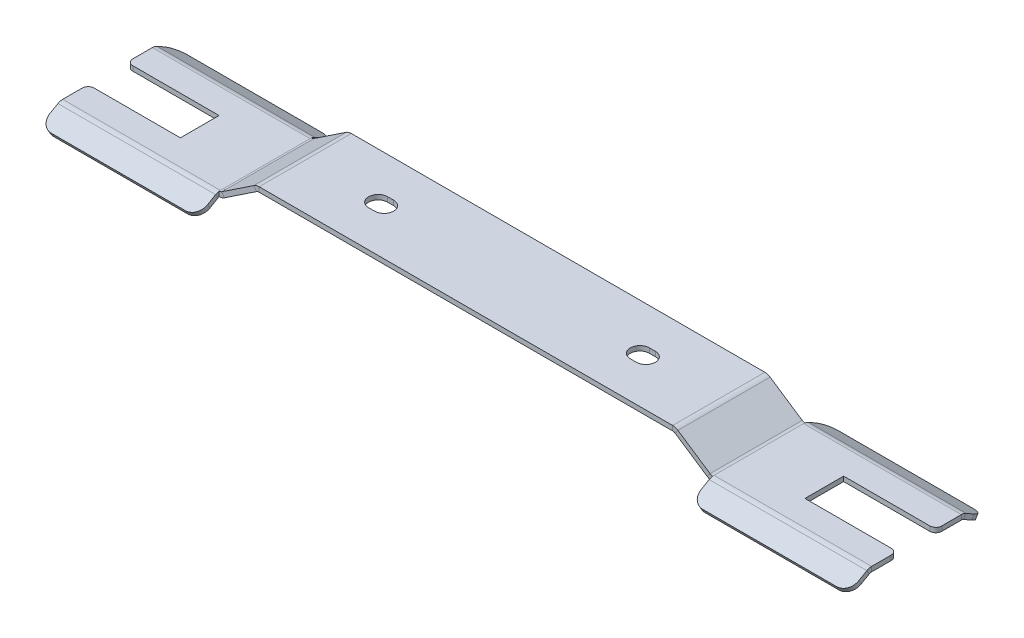
from build123d import *

# Parameters (mm, degrees)
SM_BASE_FLANGE_1_DEPTH             = 77.5
SKETCH_6_W                         = 155
SKETCH_6_H                         = 65
CUT_EXTRUDE_1_DEPTH                = 687.083267541
CUT_EXTRUDE_2_DEPTH                = 687.083267541
SM_EDGE_FLANGE_2_STRIP_CUT_DEPTH   = 265.155589796
SM_EDGE_FLANGE_2_STRIP_CUT_2_DEPTH = 265.155589796
SM_EDGE_FLANGE_2_STRIP_CUT_3_DEPTH = 265.155589796
SM_EDGE_FLANGE_2_STRIP_CUT_4_DEPTH = 265.155589796
SM_EDGE_FLANGE_2_DEPTH             = 265.155589796
SM_EDGE_FLANGE_2_BEND_DEPTH        = 265.155589796
SM_EDGE_FLANGE_2_BEND_2_DEPTH      = 265.155589796
SM_EDGE_FLANGE_2_BEND_3_DEPTH      = 265.155589796
FILLET_1_R                         = 10
FILLET_2_R                         = 20


# Sheet-metal steps are written as plain solids
with BuildPart() as part:
    # Sketch 1 → 基体-法兰1 (new, symmetric)
    with BuildSketch(Plane.XY):
        with BuildLine():
            Line((-680, -40), (-414.844410204, -40))
            ThreePointArc((-414.844410204, -40), (-410.207863825, -39.313472424), (-405.969207064, -37.312804709))
            Line((-405.969207064, -37.312804709), (-352.015396468, -1.343597645))
            ThreePointArc((-352.015396468, -1.343597645), (-349.896068088, -0.343263788), (-347.577794898, 0))
            Line((-347.577794898, 0), (347.577794898, 0))
            ThreePointArc((347.577794898, 0), (349.896068088, -0.343263788), (352.015396468, -1.343597645))
            Line((352.015396468, -1.343597645), (405.969207064, -37.312804709))
            ThreePointArc((405.969207064, -37.312804709), (410.207863825, -39.313472424), (414.844410204, -40))
            Line((414.844410204, -40), (680, -40))
            Line((680, -40), (680, -32))
            Line((680, -32), (414.844410204, -32))
            ThreePointArc((414.844410204, -32), (412.526137014, -31.656736212), (410.406808634, -30.656402355))
            Line((410.406808634, -30.656402355), (356.452998038, 5.312804709))
            ThreePointArc((356.452998038, 5.312804709), (352.214341277, 7.313472424), (347.577794898, 8))
            Line((347.577794898, 8), (-347.577794898, 8))
            ThreePointArc((-347.577794898, 8), (-352.214341277, 7.313472424), (-356.452998038, 5.312804709))
            Line((-356.452998038, 5.312804709), (-410.406808634, -30.656402355))
            ThreePointArc((-410.406808634, -30.656402355), (-412.526137014, -31.656736212), (-414.844410204, -32))
            Line((-414.844410204, -32), (-680, -32))
            Line((-680, -32), (-680, -40))
        make_face()
    extrude(amount=SM_BASE_FLANGE_1_DEPTH, both=True)

    # 草图6 → 切除-拉伸1 (cut, through all)
    with BuildSketch(Plane(origin=(0, 8, 0), x_dir=(1, 0, 0), z_dir=(0, 1, 0))):
        with Locations((-602.5, 0)):
            Rectangle(SKETCH_6_W, SKETCH_6_H)
        with Locations((602.5, 0)):
            Rectangle(SKETCH_6_W, SKETCH_6_H)
    extrude(amount=-CUT_EXTRUDE_1_DEPTH, mode=Mode.SUBTRACT)

    # 草图7 → 切除-拉伸2 (cut, through all)
    with BuildSketch(Plane(origin=(0, 8, 0), x_dir=(1, 0, 0), z_dir=(0, 1, 0))):
        with BuildLine():
            Line((-225, 16), (-215, 16))
            ThreePointArc((-215, 16), (-199, 0), (-215, -16))
            Line((-215, -16), (-225, -16))
            ThreePointArc((-225, -16), (-241, 0), (-225, 16))
        make_face()
        with BuildLine():
            Line((215, 16), (225, 16))
            ThreePointArc((225, 16), (241, 0), (225, -16))
            Line((225, -16), (215, -16))
            ThreePointArc((215, -16), (199, 0), (215, 16))
        make_face()
    extrude(amount=-CUT_EXTRUDE_2_DEPTH, mode=Mode.SUBTRACT)

    # 边线-法兰2 strip (across the edge) → 边线-法兰2 strip cut (cut)
    with BuildSketch(Plane(origin=(-680, -40, -77.5), x_dir=(0, -0.8660254037844416, 0.49999999999999495), z_dir=(1, 0, 0))):
        Polygon((-29.856406461, 35.712812921), (-5.856406461, -5.856406461), (1.07179677, -1.856406461), (-22.92820323, 39.712812921), align=None)
    extrude(amount=SM_EDGE_FLANGE_2_STRIP_CUT_DEPTH, mode=Mode.SUBTRACT)

    # 边线-法兰2 strip 2 (across the edge) → 边线-法兰2 strip cut 2 (cut)
    with BuildSketch(Plane(origin=(680, -40, 77.5), x_dir=(0, -0.8660254037844416, -0.49999999999999495), z_dir=(-1, 0, 0))):
        Polygon((-29.856406461, 35.712812921), (-5.856406461, -5.856406461), (1.07179677, -1.856406461), (-22.92820323, 39.712812921), align=None)
    extrude(amount=SM_EDGE_FLANGE_2_STRIP_CUT_2_DEPTH, mode=Mode.SUBTRACT)

    # 边线-法兰2 strip 3 (across the edge) → 边线-法兰2 strip cut 3 (cut)
    with BuildSketch(Plane(origin=(414.844410204, -40, -77.5), x_dir=(0, -0.8660254037844416, 0.49999999999999495), z_dir=(1, 0, 0))):
        Polygon((-29.856406461, 35.712812921), (-5.856406461, -5.856406461), (1.07179677, -1.856406461), (-22.92820323, 39.712812921), align=None)
    extrude(amount=SM_EDGE_FLANGE_2_STRIP_CUT_3_DEPTH, mode=Mode.SUBTRACT)

    # 边线-法兰2 strip 4 (across the edge) → 边线-法兰2 strip cut 4 (cut)
    with BuildSketch(Plane(origin=(-414.844410204, -40, 77.5), x_dir=(0, -0.8660254037844416, -0.49999999999999495), z_dir=(-1, 0, 0))):
        Polygon((-29.856406461, 35.712812921), (-5.856406461, -5.856406461), (1.07179677, -1.856406461), (-22.92820323, 39.712812921), align=None)
    extrude(amount=SM_EDGE_FLANGE_2_STRIP_CUT_4_DEPTH, mode=Mode.SUBTRACT)

    # 边线-法兰2 section (across the edge) → 边线-法兰2 (add)
    with BuildSketch(Plane(origin=(-680, -40, -77.5), x_dir=(0, -0.8660254037844416, 0.49999999999999495), z_dir=(1, 0, 0))):
        with BuildLine():
            Line((-8, 2.143593539), (-8, 37.856406461))
            Line((-8, 37.856406461), (0, 37.856406461))
            Line((0, 37.856406461), (0, 2.143593539))
            ThreePointArc((0, 2.143593539), (0.27259339, 0.073041179), (1.07179677, -1.856406461))
            Line((1.07179677, -1.856406461), (-5.856406461, -5.856406461))
            ThreePointArc((-5.856406461, -5.856406461), (-7.454813221, -1.997511182), (-8, 2.143593539))
        make_face()
    extrude(amount=SM_EDGE_FLANGE_2_DEPTH)

    # 边线-法兰2 section 2 (across the edge) → 边线-法兰2 bend (add)
    with BuildSketch(Plane(origin=(680, -40, 77.5), x_dir=(0, -0.8660254037844416, -0.49999999999999495), z_dir=(-1, 0, 0))):
        with BuildLine():
            Line((-8, 2.143593539), (-8, 37.856406461))
            Line((-8, 37.856406461), (0, 37.856406461))
            Line((0, 37.856406461), (0, 2.143593539))
            ThreePointArc((0, 2.143593539), (0.27259339, 0.073041179), (1.07179677, -1.856406461))
            Line((1.07179677, -1.856406461), (-5.856406461, -5.856406461))
            ThreePointArc((-5.856406461, -5.856406461), (-7.454813221, -1.997511182), (-8, 2.143593539))
        make_face()
    extrude(amount=SM_EDGE_FLANGE_2_BEND_DEPTH)

    # 边线-法兰2 section 3 (across the edge) → 边线-法兰2 bend 2 (add)
    with BuildSketch(Plane(origin=(414.844410204, -40, -77.5), x_dir=(0, -0.8660254037844416, 0.49999999999999495), z_dir=(1, 0, 0))):
        with BuildLine():
            Line((-8, 2.143593539), (-8, 37.856406461))
            Line((-8, 37.856406461), (0, 37.856406461))
            Line((0, 37.856406461), (0, 2.143593539))
            ThreePointArc((0, 2.143593539), (0.27259339, 0.073041179), (1.07179677, -1.856406461))
            Line((1.07179677, -1.856406461), (-5.856406461, -5.856406461))
            ThreePointArc((-5.856406461, -5.856406461), (-7.454813221, -1.997511182), (-8, 2.143593539))
        make_face()
    extrude(amount=SM_EDGE_FLANGE_2_BEND_2_DEPTH)

    # 边线-法兰2 section 4 (across the edge) → 边线-法兰2 bend 3 (add)
    with BuildSketch(Plane(origin=(-414.844410204, -40, 77.5), x_dir=(0, -0.8660254037844416, -0.49999999999999495), z_dir=(-1, 0, 0))):
        with BuildLine():
            Line((-8, 2.143593539), (-8, 37.856406461))
            Line((-8, 37.856406461), (0, 37.856406461))
            Line((0, 37.856406461), (0, 2.143593539))
            ThreePointArc((0, 2.143593539), (0.27259339, 0.073041179), (1.07179677, -1.856406461))
            Line((1.07179677, -1.856406461), (-5.856406461, -5.856406461))
            ThreePointArc((-5.856406461, -5.856406461), (-7.454813221, -1.997511182), (-8, 2.143593539))
        make_face()
    extrude(amount=SM_EDGE_FLANGE_2_BEND_3_DEPTH)

    # 圆角1
    fillet_1_edges = [part.edges().sort_by_distance(p)[0] for p in [
        (-680, -36, 32.5),
        (-680, -36, -32.5),
        (680, -36, -32.5),
        (680, -36, 32.5),
    ]]
    fillet(fillet_1_edges, radius=FILLET_1_R)

    # 圆角2
    fillet_2_edges = [part.edges().sort_by_distance(p)[0] for p in [
        (-680, -55.464101615, -112.284609691),
        (-414.844410204, -55.464101615, -112.284609691),
        (680, -55.464101615, 112.284609691),
        (414.844410204, -55.464101615, 112.284609691),
        (414.844410204, -55.464101615, -112.284609691),
        (680, -55.464101615, -112.284609691),
        (-414.844410204, -55.464101615, 112.284609691),
        (-680, -55.464101615, 112.284609691),
    ]]
    fillet(fillet_2_edges, radius=FILLET_2_R)


solid = part.part
